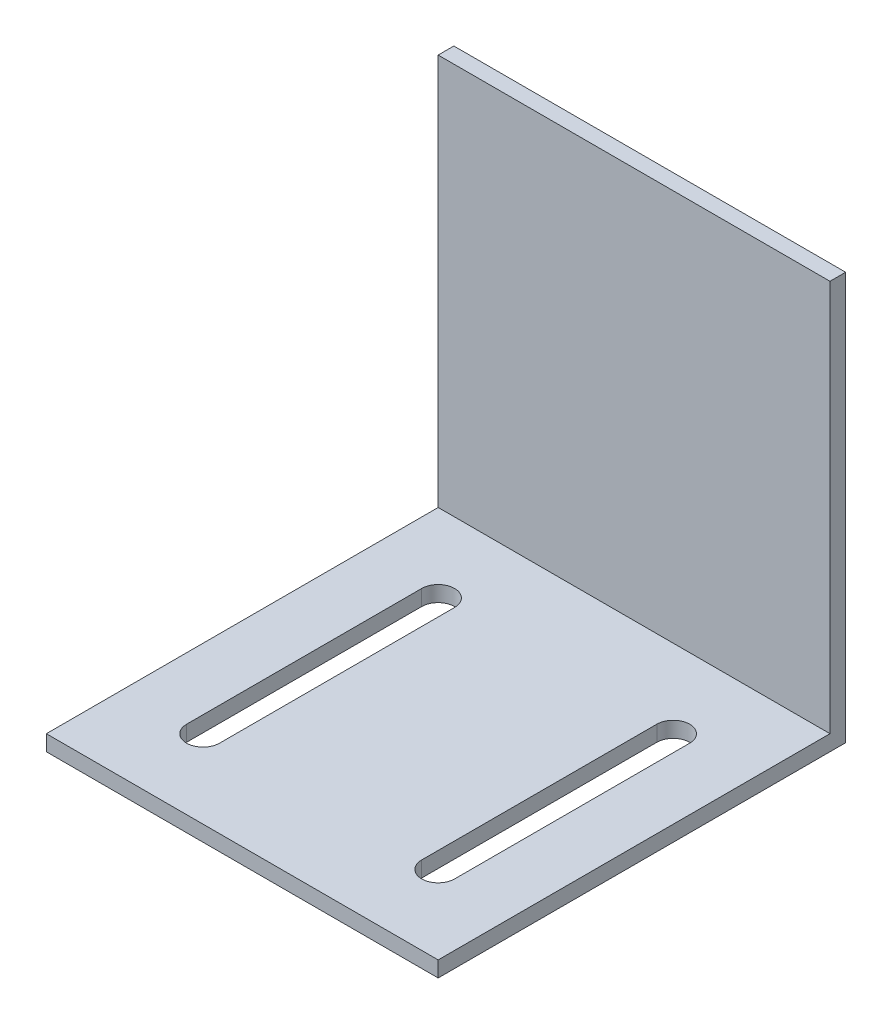
from build123d import *

# Parameters (mm, degrees)
SKETCH1_W           = 50
SKETCH1_H           = 50
BOSS_EXTRUDE1_DEPTH = 2
SKETCH2_W           = 50
SKETCH2_H           = 2
BOSS_EXTRUDE2_DEPTH = 52


with BuildPart() as part:
    # Sketch1 → Boss-Extrude1 (new body)
    with BuildSketch(Plane(origin=(0, 0, 0), x_dir=(1, 0, 0), z_dir=(0, 1, 0))):
        Rectangle(SKETCH1_W, SKETCH1_H)
        with BuildLine():
            Line((-17.1, 15), (-17.1, -15))
            ThreePointArc((-17.1, -15), (-15, -17.1), (-12.9, -15))
            Line((-12.9, -15), (-12.9, 15))
            ThreePointArc((-12.9, 15), (-15, 17.1), (-17.1, 15))
        make_face(mode=Mode.SUBTRACT)
        with BuildLine():
            Line((17.1, 15), (17.1, -15))
            ThreePointArc((17.1, -15), (15, -17.1), (12.9, -15))
            Line((12.9, -15), (12.9, 15))
            ThreePointArc((12.9, 15), (15, 17.1), (17.1, 15))
        make_face(mode=Mode.SUBTRACT)
    extrude(amount=BOSS_EXTRUDE1_DEPTH)

    # Sketch2 → Boss-Extrude2 (add)
    with BuildSketch(Plane.XZ):
        with Locations((0, -26)):
            Rectangle(SKETCH2_W, SKETCH2_H)
    extrude(amount=-BOSS_EXTRUDE2_DEPTH)


solid = part.part
